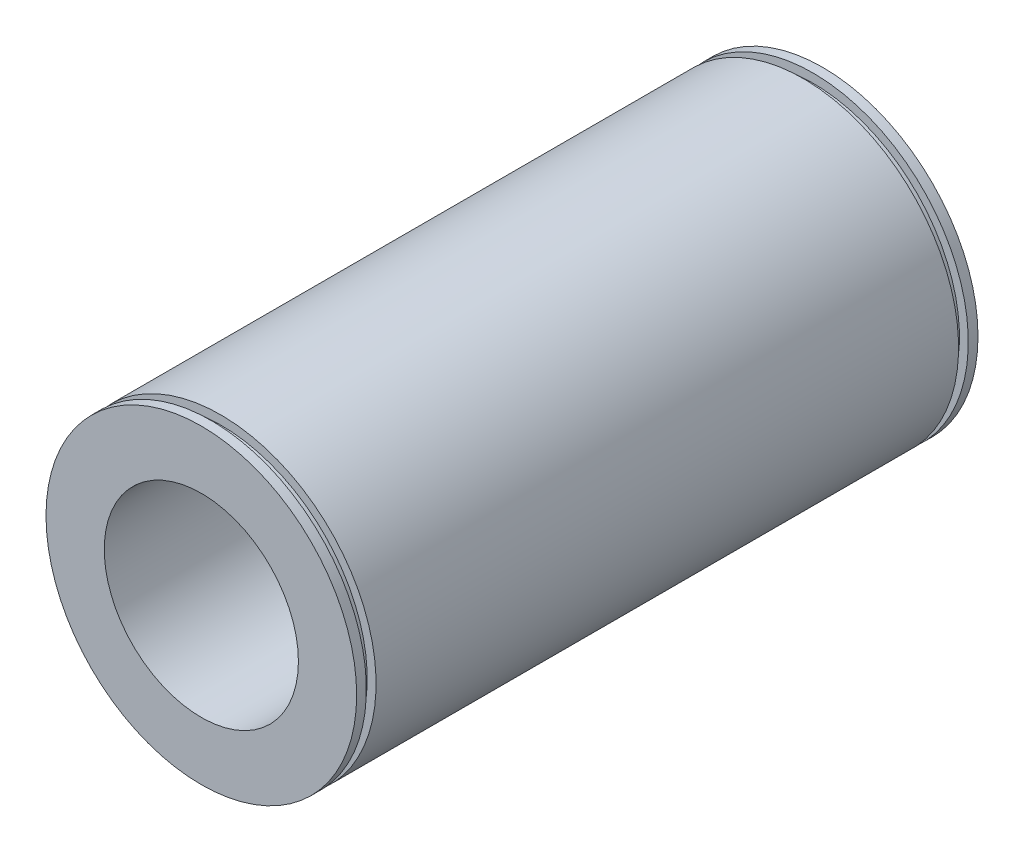
from build123d import *

# Parameters (mm, degrees)
SKETCH1_R           = 25.4
SKETCH1_R_2         = 15.875
BOSS_EXTRUDE1_DEPTH = 50.8
SKETCH2_W           = 1.5875
SKETCH2_H           = 1.4478


with BuildPart() as part:
    # Sketch1 → Boss-Extrude1 (new, symmetric)
    with BuildSketch(Plane.XY):
        Circle(SKETCH1_R)
        Circle(SKETCH1_R_2, mode=Mode.SUBTRACT)
    extrude(amount=BOSS_EXTRUDE1_DEPTH, both=True)

    # Sketch2 → Cut-Revolve1 (revolve, cut)
    with BuildSketch(Plane(origin=(0, 0, 0), x_dir=(0, 0, -1), z_dir=(1, 0, 0))):
        with Locations((-48.41875, 24.6761)):
            Rectangle(SKETCH2_W, SKETCH2_H)
    cut_revolve1 = revolve(axis=Axis((0, 0, 0), (0, 0, 1)), mode=Mode.SUBTRACT)

    # Mirror1: Cut-Revolve1 across plane
    add(cut_revolve1.mirror(Plane.XY), mode=Mode.SUBTRACT)


solid = part.part
